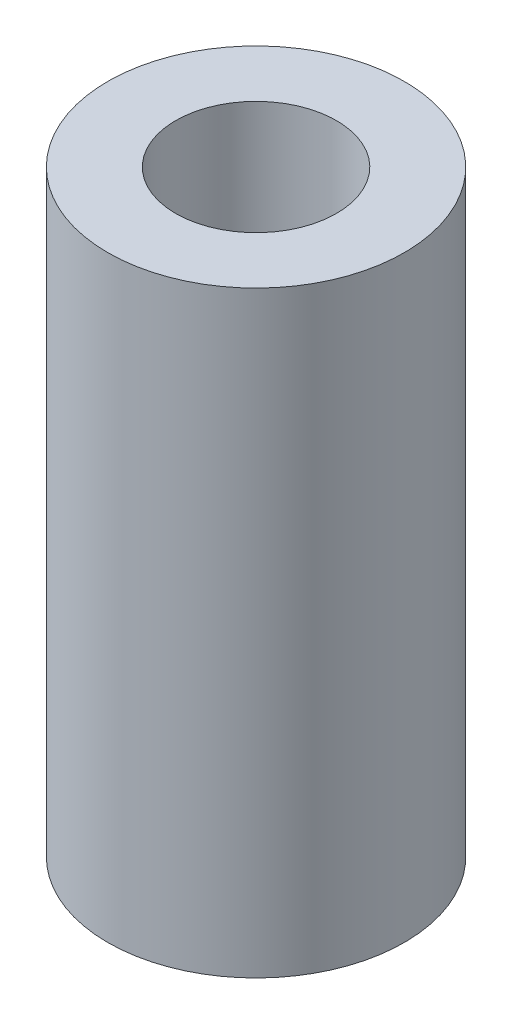
from build123d import *

# Parameters (mm, degrees)
SKETCH1_R           = 10
BOSS_EXTRUDE1_DEPTH = 40.289985852
SKETCH2_R           = 5.424896001
CUT_EXTRUDE1_DEPTH  = 43.699917563


with BuildPart() as part:
    # Sketch1 → Boss-Extrude1 (new body)
    with BuildSketch(Plane(origin=(0, 0, 0), x_dir=(1, 0, 0), z_dir=(0, 1, 0))):
        Circle(SKETCH1_R)
    extrude(amount=BOSS_EXTRUDE1_DEPTH)

    # Sketch2 → Cut-Extrude1 (cut, through all)
    with BuildSketch(Plane(origin=(0, 0, 0), x_dir=(1, 0, 0), z_dir=(0, 1, 0))):
        Circle(SKETCH2_R)
    extrude(amount=CUT_EXTRUDE1_DEPTH, mode=Mode.SUBTRACT)


solid = part.part
